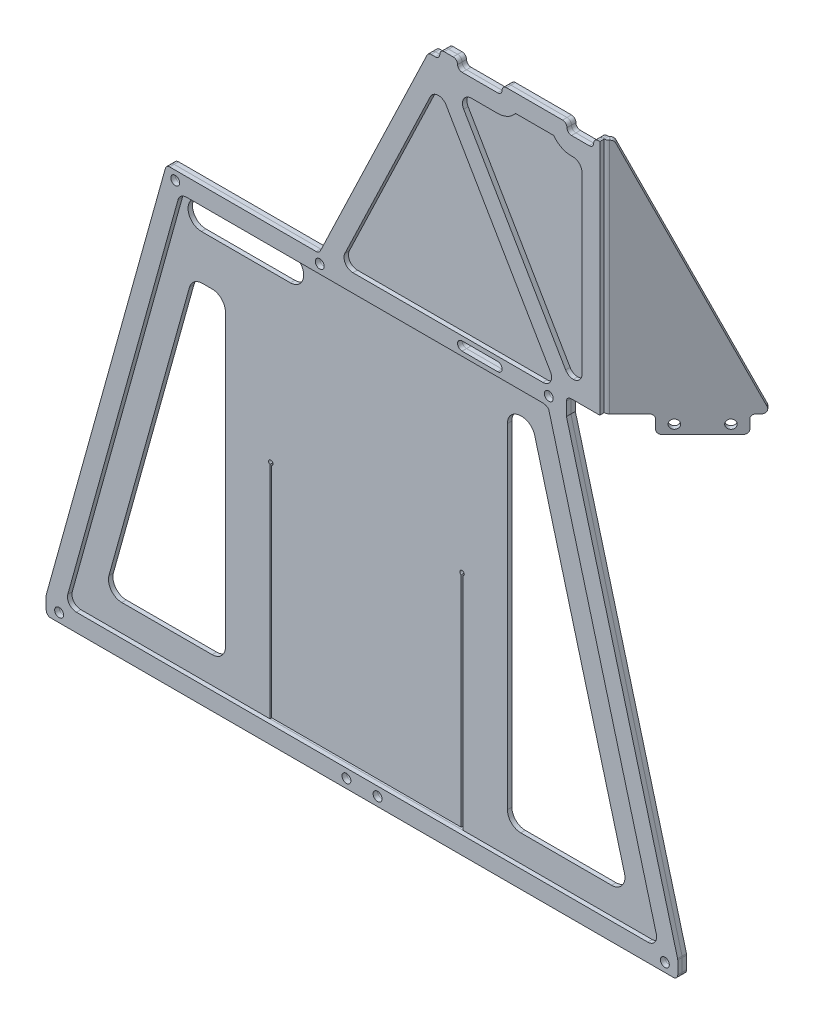
from build123d import *

# Parameters (mm, degrees)
SM_BASE_FLANGE_1_DEPTH      = 266.5
SM_BASE_FLANGE_1_DEPTH_BACK = 20
EXTRUDE_2_DEPTH             = 5
CUT_EXTRUDE_1_DEPTH         = 781.997587301
SKETCH_16_R                 = 5
CUT_EXTRUDE_6_DEPTH         = 804.201519225
CUT_EXTRUDE_7_DEPTH         = 780.82164677
SKETCH_18_W                 = 41.523044305
SKETCH_18_H                 = 20
SKETCH_18_R                 = 5
CUT_EXTRUDE_8_DEPTH         = 780.82164677
CUT_EXTRUDE_9_DEPTH         = 5
CUT_EXTRUDE_10_DEPTH        = 780.82164677
FILLET_1_R                  = 5
FILLET_2_R                  = 15
FILLET_3_R                  = 5
SKETCH_26_R                 = 5
EXTRUDE_3_DEPTH             = 5
FILLET_4_R                  = 10


# Sheet-metal steps are written as plain solids
# Some blends are built 0.0001 mm under size
with BuildPart() as part:
    # Sketch 1 → ﾍﾞｰｽ-ﾌﾗﾝｼﾞ1 (new, two sides: drawn at the far end of the back side and taken through both)
    with BuildSketch(Plane(origin=(0, 0, 0), x_dir=(1, 0, 0), z_dir=(0, 1, 0)).offset(-SM_BASE_FLANGE_1_DEPTH_BACK)):
        with BuildLine():
            Line((137.550775542, 90.408639918), (37.357880769, -9.784254855))
            ThreePointArc((37.357880769, -9.784254855), (37.11891053, -9.943929664), (36.837025914, -10))
            Line((36.837025914, -10), (30, -10))
            Line((30, -10), (-450.5, -10))
            Line((-450.5, -10), (-450.5, -15))
            Line((-450.5, -15), (30, -15))
            Line((30, -15), (36.837025914, -15))
            ThreePointArc((36.837025914, -15), (39.032327692, -14.563327326), (40.893414675, -13.319788761))
            Line((40.893414675, -13.319788761), (141.086309448, 86.873106012))
            Line((141.086309448, 86.873106012), (137.550775542, 90.408639918))
        make_face()
    extrude(amount=SM_BASE_FLANGE_1_DEPTH + SM_BASE_FLANGE_1_DEPTH_BACK)

    # ｽｹｯﾁ15 → ﾎﾞｽ - 押し出し2 (add)
    with BuildSketch(Plane.XY.offset(15)):
        Polygon((-450.5, 0), (-585.5, -486), (-585.5, -506), (124.5, -506), (124.5, -486), (-6, 0), align=None)
    extrude(amount=-EXTRUDE_2_DEPTH)

    # ｽｹｯﾁ7 → ｶｯﾄ - 押し出し1 (cut, through all)
    with BuildSketch(Plane.XY.offset(15)):
        Polygon((-278.755408603, 0), (-151.149515417, 266.5), (-450.5, 266.5), (-450.5, 0), align=None)
    extrude(amount=-CUT_EXTRUDE_1_DEPTH, mode=Mode.SUBTRACT)

    # ｽｹｯﾁ16 → ｶｯﾄ - 押し出し6 (cut, through all)
    with BuildSketch(Plane(origin=(27.106601718, 0, 27.106601718), x_dir=(0.7071067811865438, 0, -0.7071067811865513), z_dir=(0.7071067811865513, 0, 0.7071067811865438))):
        with BuildLine():
            Line((23.323748893, 266.5), (148.323748893, 0))
            Line((148.323748893, 0), (136.191648507, 0))
            ThreePointArc((136.191648507, 0), (132.656114601, -1.464466094), (131.191648507, -5))
            Line((131.191648507, -5), (131.191648507, -20))
            Line((131.191648507, -20), (141.191648507, -20))
            Line((141.191648507, -20), (161.191648507, -20))
            Line((161.191648507, -20), (161.191648507, 266.5))
            Line((161.191648507, 266.5), (23.323748893, 266.5))
        make_face()
        with BuildLine():
            Line((51.191648507, 0), (19.497497865, 0))
            Line((19.497497865, 0), (19.497497865, -20))
            Line((19.497497865, -20), (46.191648507, -20))
            Line((46.191648507, -20), (56.191648507, -20))
            Line((56.191648507, -20), (56.191648507, -5))
            ThreePointArc((56.191648507, -5), (54.727182413, -1.464466094), (51.191648507, 0))
        make_face()
        with Locations(Location((116.191648507, -10, 0), (0, 0, 180))):
            Circle(SKETCH_16_R)
        with Locations(Location((71.191648507, -10, 0), (0, 0, 180))):
            Circle(SKETCH_16_R)
    extrude(amount=-CUT_EXTRUDE_6_DEPTH, mode=Mode.SUBTRACT)

    # ｽｹｯﾁ17 → ｶｯﾄ - 押し出し7 (cut, through all)
    with BuildSketch(Plane.XY.offset(15)):
        with BuildLine():
            Line((-416.055555556, -20), (-316.055555556, -20))
            ThreePointArc((-316.055555556, -20), (-301.055555556, -35), (-316.055555556, -50))
            Line((-316.055555556, -50), (-416.055555556, -50))
            ThreePointArc((-416.055555556, -50), (-431.055555556, -35), (-416.055555556, -20))
        make_face()
    extrude(amount=-CUT_EXTRUDE_7_DEPTH, mode=Mode.SUBTRACT)

    # ｽｹｯﾁ18 → ｶｯﾄ - 押し出し8 (cut, through all)
    with BuildSketch(Plane.XY.offset(15)):
        with BuildLine():
            Line((-78, -5), (-118, -5))
            ThreePointArc((-118, -5), (-123, -10), (-118, -15))
            Line((-118, -15), (-78, -15))
            ThreePointArc((-78, -15), (-73, -10), (-78, -5))
        make_face()
        with BuildLine():
            Line((-123, 266.5), (-123, 261.5))
            ThreePointArc((-123, 261.5), (-121.535533906, 257.964466094), (-118, 256.5))
            Line((-118, 256.5), (-78, 256.5))
            ThreePointArc((-78, 256.5), (-74.464466094, 257.964466094), (-73, 261.5))
            Line((-73, 261.5), (-73, 266.5))
            Line((-73, 266.5), (-123, 266.5))
        make_face()
        with BuildLine():
            ThreePointArc((0, 261.5), (1.464466094, 257.964466094), (5, 256.5))
            Line((5, 256.5), (25, 256.5))
            ThreePointArc((25, 256.5), (28.535533906, 257.964466094), (30, 261.5))
            Line((30, 261.5), (30, 266.5))
            Line((30, 266.5), (0, 266.5))
            Line((0, 266.5), (0, 261.5))
        make_face()
        with BuildLine():
            Line((-143, 266.5), (-151.149515417, 266.5))
            Line((-151.149515417, 266.5), (-155.937729045, 256.5))
            Line((-155.937729045, 256.5), (-148, 256.5))
            ThreePointArc((-148, 256.5), (-144.464466094, 257.964466094), (-143, 261.5))
            Line((-143, 261.5), (-143, 266.5))
        make_face()
        with Locations((20.131892523, -10)):
            Rectangle(SKETCH_18_W, SKETCH_18_H)
        with Locations(Location((110, -496, 0), (0, 0, 180))):
            Circle(SKETCH_18_R)
        with Locations(Location((-571, -496, 0), (0, 0, 180))):
            Circle(SKETCH_18_R)
        with Locations(Location((-213, -496, 0), (0, 0, 180))):
            Circle(SKETCH_18_R)
        with Locations(Location((-248, -496, 0), (0, 0, 180))):
            Circle(SKETCH_18_R)
        with Locations(Location((-440.5, -10, 0), (0, 0, 180))):
            Circle(SKETCH_18_R)
        with Locations(Location((-20.5, -10, 0), (0, 0, 180))):
            Circle(SKETCH_18_R)
        with Locations(Location((-278, -10, 0), (0, 0, 180))):
            Circle(SKETCH_18_R)
    extrude(amount=-CUT_EXTRUDE_8_DEPTH, mode=Mode.SUBTRACT)

    # ｽｹｯﾁ24 → ｶｯﾄ - 押し出し9 (cut)
    with BuildSketch(Plane.XY.offset(15)):
        with BuildLine():
            ThreePointArc((-337, -238.291287847), (-338, -233.5), (-339, -238.291287847))
            Line((-339, -238.291287847), (-339, -486))
            Line((-339, -486), (-122, -486))
            Line((-122, -486), (-122, -238.291287847))
            ThreePointArc((-122, -238.291287847), (-123, -233.5), (-124, -238.291287847))
            Line((-124, -238.291287847), (-124, -484))
            Line((-124, -484), (-337, -484))
            Line((-337, -484), (-337, -238.291287847))
        make_face()
    extrude(amount=-CUT_EXTRUDE_9_DEPTH, mode=Mode.SUBTRACT)

    # ｽｹｯﾁ25 → ｶｯﾄ - 押し出し10 (cut, through all)
    with BuildSketch(Plane.XY.offset(15)):
        Polygon((-389, -238.291287847), (-389, -100), (-412.495717521, -100), (-426.38460641, -100), (-525.273495299, -456), (-389, -456), align=None)
        Polygon((-44.345258018, -50), (-72, -50), (-72, -238.291287847), (-72, -456), (64.6732605, -456), align=None)
    extrude(amount=-CUT_EXTRUDE_10_DEPTH, mode=Mode.SUBTRACT)

    # ﾌｨﾚｯﾄ1
    fillet_1_edges = [part.edges().sort_by_distance(p)[0] for p in [
        (-0.62962963, 0, 12.5),
    ]]
    fillet(fillet_1_edges, radius=FILLET_1_R)

    # ﾌｨﾚｯﾄ2
    fillet_2_edges = [part.edges().sort_by_distance(p)[0] for p in [
        (-426.38460641, -100, 12.5),
        (-389, -100, 12.5),
        (-389, -456, 12.5),
        (-525.273495299, -456, 12.5),
        (-72, -456, 12.5),
        (-72, -50, 12.5),
        (-44.345258018, -50, 12.5),
        (64.6732605, -456, 12.5),
    ]]
    fillet(fillet_2_edges, radius=FILLET_2_R)

    # ﾌｨﾚｯﾄ3
    fillet_3_edges = [part.edges().sort_by_distance(p)[0] for p in [
        (-155.937729045, 256.5, 12.5),
        (-143, 266.5, 12.5),
        (-123, 266.5, 12.5),
        (-73, 266.5, 12.5),
        (0, 266.5, 12.5),
        (30, 266.5, 12.5),
        (41.831215769, 266.5, 8.84645376),
        (130.219563418, 0, -79.541893888),
        (118.105339059, -20, -67.42766953),
        (65.07233047, -20, -14.394660941),
        (124.5, -486, 12.5),
        (124.5, -506, 12.5),
        (-585.5, -506, 12.5),
        (-585.5, -486, 12.5),
        (-450.5, 0, 12.5),
        (-278.755408603, 0, 12.5),
    ]]
    fillet(fillet_3_edges, radius=FILLET_3_R - 0.0001)  # a hair under: the kernel refuses the full size


with BuildPart() as body_2:
    # ｽｹｯﾁ26 → ﾎﾞｽ - 押し出し3 (new body)
    with BuildSketch(Plane.XY.offset(15)):
        with BuildLine():
            ThreePointArc((-0.62962963, -5), (0.834836464, -1.464466094), (4.37037037, 0))
            Line((4.37037037, 0), (36.837025914, 0))
            Line((36.837025914, 0), (36.837025914, 266.5))
            Line((36.837025914, 266.5), (35, 266.5))
            ThreePointArc((35, 266.5), (31.464466094, 265.035533906), (30, 261.5))
            ThreePointArc((30, 261.5), (28.535533906, 257.964466094), (25, 256.5))
            Line((25, 256.5), (5, 256.5))
            ThreePointArc((5, 256.5), (1.464466094, 257.964466094), (0, 261.5))
            ThreePointArc((0, 261.5), (-1.464466094, 265.035533906), (-5, 266.5))
            Line((-5, 266.5), (-68, 266.5))
            ThreePointArc((-68, 266.5), (-71.535533906, 265.035533906), (-73, 261.5))
            ThreePointArc((-73, 261.5), (-74.464466094, 257.964466094), (-78, 256.5))
            Line((-78, 256.5), (-118, 256.5))
            ThreePointArc((-118, 256.5), (-121.535533906, 257.964466094), (-123, 261.5))
            ThreePointArc((-123, 261.5), (-124.464466094, 265.035533906), (-128, 266.5))
            Line((-128, 266.5), (-138, 266.5))
            ThreePointArc((-138, 266.5), (-141.535533906, 265.035533906), (-143, 261.5))
            ThreePointArc((-143, 261.5), (-144.464466094, 257.964466094), (-148, 256.5))
            Line((-148, 256.5), (-152.788213628, 256.5))
            ThreePointArc((-152.788213628, 256.5), (-155.453108382, 255.730642498), (-157.297900428, 253.65933438))
            Line((-157.297900428, 253.65933438), (-277.395237219, 2.84066562))
            ThreePointArc((-277.395237219, 2.84066562), (-279.240029265, 0.769357502), (-281.904924019, 0))
            Line((-281.904924019, 0), (-446.699571752, 0))
            ThreePointArc((-446.699571752, 0), (-449.725204199, -1.019353282), (-451.5171613, -3.661780681))
            Line((-451.5171613, -3.661780681), (-585.317589548, -485.343322373))
            ThreePointArc((-585.317589548, -485.343322373), (-585.454187509, -486.006244625), (-585.5, -486.681541692))
            Line((-585.5, -486.681541692), (-585.5, -501))
            ThreePointArc((-585.5, -501), (-584.035533906, -504.535533906), (-580.5, -506))
            Line((-580.5, -506), (119.5, -506))
            ThreePointArc((119.5, -506), (123.035533906, -504.535533906), (124.5, -501))
            Line((124.5, -501), (124.5, -486.659613331))
            ThreePointArc((124.5, -486.659613331), (124.457050822, -486.00566597), (124.32894114, -485.36295321))
            Line((124.32894114, -485.36295321), (-0.62962963, -20))
            Line((-0.62962963, -20), (-0.62962963, -5))
        make_face()
        with Locations((-571, -496)):
            Circle(SKETCH_26_R, mode=Mode.SUBTRACT)
        with Locations((-248, -496)):
            Circle(SKETCH_26_R, mode=Mode.SUBTRACT)
        with Locations((-213, -496)):
            Circle(SKETCH_26_R, mode=Mode.SUBTRACT)
        with Locations((110, -496)):
            Circle(SKETCH_26_R, mode=Mode.SUBTRACT)
        Polygon((-435.298287009, -20), (-20.62962963, -20), (-20.62962963, -22.638453324), (103.791526422, -486), (-564.742731453, -486), align=None, mode=Mode.SUBTRACT)
        with Locations((-440.5, -10)):
            Circle(SKETCH_26_R, mode=Mode.SUBTRACT)
        with Locations((-278, -10)):
            Circle(SKETCH_26_R, mode=Mode.SUBTRACT)
        with BuildLine():
            ThreePointArc((-118, -15), (-123, -10), (-118, -5))
            Line((-118, -5), (-78, -5))
            ThreePointArc((-78, -5), (-73, -10), (-78, -15))
            Line((-78, -15), (-118, -15))
        make_face(mode=Mode.SUBTRACT)
        with Locations((-20.5, -10)):
            Circle(SKETCH_26_R, mode=Mode.SUBTRACT)
        with BuildLine():
            Line((16.837025914, 20), (4.37037037, 20))
            ThreePointArc((4.37037037, 20), (2.913171693, 19.957495307), (1.460928038, 19.830125761))
            Line((1.460928038, 19.830125761), (-125.6549482, 237.700803206))
            ThreePointArc((-125.6549482, 237.700803206), (-121.874279297, 236.802025186), (-118, 236.5))
            Line((-118, 236.5), (-78, 236.5))
            ThreePointArc((-78, 236.5), (-66.819660113, 239.139320225), (-58, 246.5))
            Line((-58, 246.5), (-15, 246.5))
            ThreePointArc((-15, 246.5), (-6.180339887, 239.139320225), (5, 236.5))
            Line((5, 236.5), (16.837025914, 236.5))
            Line((16.837025914, 236.5), (16.837025914, 20))
        make_face(mode=Mode.SUBTRACT)
        with BuildLine():
            Line((-256.58091968, 0), (-145.489713839, 232.00971066))
            Line((-145.489713839, 232.00971066), (-15.813799346, 9.751247162))
            ThreePointArc((-15.813799346, 9.751247162), (-18.495028501, 5.108092524), (-20.124527057, 0))
            Line((-20.124527057, 0), (-256.58091968, 0))
        make_face(mode=Mode.SUBTRACT)
    extrude(amount=EXTRUDE_3_DEPTH)

    # ﾌｨﾚｯﾄ4
    # the kernel refuses this fillet: 10 mm, written as the material it adds along each edge
    with BuildSketch(Plane(origin=(16.837025914, 236.5, 15), x_dir=(-1, 0, 0), z_dir=(0, 0, 1)), Plane(origin=(16.837025914, 20, 15), x_dir=(0, 1, 0), z_dir=(0, 0, 1))) as fillet_4_piece_1:
        with BuildLine():
            CenterArc((FILLET_4_R, FILLET_4_R), FILLET_4_R, 180, 90)
            Line((0, FILLET_4_R), (-FILLET_4_R * 0.02, FILLET_4_R))
            Line((-FILLET_4_R * 0.02, FILLET_4_R), (-FILLET_4_R * 0.02, -FILLET_4_R * 0.02))
            Line((-FILLET_4_R * 0.02, -FILLET_4_R * 0.02), (FILLET_4_R, -FILLET_4_R * 0.02))
            Line((FILLET_4_R, -FILLET_4_R * 0.02), (FILLET_4_R, 0))
        make_face()
    extrude(amount=5)
    with BuildSketch(Plane(origin=(-20.124527057, 0, 15), x_dir=(0.31659196881654045, 0.9485618194302713, 0), z_dir=(0, 0, 1))) as fillet_4_piece_2:
        with BuildLine():
            CenterArc((7.228988893, 9.927153726), FILLET_4_R, 198.456946279, 64.623066475)
            Line((-2.256629301, 6.761234038), (-2.446341665, 6.697915644))
            Line((-2.446341665, 6.697915644), (-0.189712364, -0.063318394))
            Line((-0.189712364, -0.063318394), (0.02409663, -0.198543075))
            ThreePointArc((0.02409663, -0.198543075), (3.012078705, -0.017884315), (6.000060781, -0.198543075))
            Line((6.000060781, -0.198543075), (6.024157411, 0))
        make_face()
    extrude(amount=5)
    with BuildSketch(Plane(origin=(-256.58091968, 0, 15), x_dir=(1, 0, 0), z_dir=(0, 0, 1))) as fillet_4_piece_3:
        with BuildLine():
            CenterArc((FILLET_4_R * 1.58754580894, FILLET_4_R), FILLET_4_R, 154.413904759, 115.586095241)
            Line((FILLET_4_R * 0.68560844887, FILLET_4_R * 1.43186687591), (FILLET_4_R * 0.667569701668, FILLET_4_R * 1.44050421343))
            Line((FILLET_4_R * 0.667569701668, FILLET_4_R * 1.44050421343), (-FILLET_4_R * 0.0317509161788, -FILLET_4_R * 0.02))
            Line((-FILLET_4_R * 0.0317509161788, -FILLET_4_R * 0.02), (FILLET_4_R * 1.58754580894, -FILLET_4_R * 0.02))
            Line((FILLET_4_R * 1.58754580894, -FILLET_4_R * 0.02), (FILLET_4_R * 1.58754580894, 0))
        make_face()
    extrude(amount=5)
    with BuildSketch(Plane(origin=(-20.62962963, -20, 15), x_dir=(-1, 0, 0), z_dir=(0, 0, 1))) as fillet_4_piece_4:
        with BuildLine():
            CenterArc((6.76813346, 10), FILLET_4_R, 227.404874266, 42.595125734)
            Line((0, 2.638453324), (-0.135362669, 2.49122239))
            ThreePointArc((-0.135362669, 2.49122239), (-0.2, 1.319226662), (-0.2, 0))
            Line((-0.2, 0), (0, -0.2))
            Line((0, -0.2), (6.76813346, -0.2))
            Line((6.76813346, -0.2), (6.76813346, 0))
        make_face()
    extrude(amount=5)
    with BuildSketch(Plane(origin=(103.791526422, -486, 15), x_dir=(-1, 0, 0), z_dir=(0, 0, 1))) as fillet_4_piece_5:
        with BuildLine():
            CenterArc((FILLET_4_R * 1.3039421974, -FILLET_4_R), FILLET_4_R, 90, 105.030430523)
            Line((FILLET_4_R * 0.338153969453, -FILLET_4_R * 1.25933202417), (FILLET_4_R * 0.318838204894, -FILLET_4_R * 1.26451866465))
            Line((FILLET_4_R * 0.318838204894, -FILLET_4_R * 1.26451866465), (-FILLET_4_R * 0.026078843948, FILLET_4_R * 0.02))
            Line((-FILLET_4_R * 0.026078843948, FILLET_4_R * 0.02), (FILLET_4_R * 1.3039421974, FILLET_4_R * 0.02))
            Line((FILLET_4_R * 1.3039421974, FILLET_4_R * 0.02), (FILLET_4_R * 1.3039421974, 0))
        make_face()
    extrude(amount=5)
    with BuildSketch(Plane(origin=(-564.742731453, -486, 15), x_dir=(1, 0, 0), z_dir=(0, 0, 1))) as fillet_4_piece_6:
        with BuildLine():
            CenterArc((FILLET_4_R * 1.31564120513, FILLET_4_R), FILLET_4_R, 164.475889003, 105.524110997)
            Line((FILLET_4_R * 0.352123295496, FILLET_4_R * 1.26764386379), (FILLET_4_R * 0.332852937304, FILLET_4_R * 1.27299674106))
            Line((FILLET_4_R * 0.332852937304, FILLET_4_R * 1.27299674106), (-FILLET_4_R * 0.0263128241025, -FILLET_4_R * 0.02))
            Line((-FILLET_4_R * 0.0263128241025, -FILLET_4_R * 0.02), (FILLET_4_R * 1.31564120513, -FILLET_4_R * 0.02))
            Line((FILLET_4_R * 1.31564120513, -FILLET_4_R * 0.02), (FILLET_4_R * 1.31564120513, 0))
        make_face()
    extrude(amount=5)
    with BuildSketch(Plane(origin=(-435.298287009, -20, 15), x_dir=(-0.2676438637860963, -0.9635179096299402, 0), z_dir=(0, 0, 1))) as fillet_4_piece_7:
        with BuildLine():
            CenterArc((FILLET_4_R * 0.760085649571, FILLET_4_R), FILLET_4_R, 195.524110997, 74.475889003)
            Line((-FILLET_4_R * 0.203432260059, FILLET_4_R * 0.732356136214), (-FILLET_4_R * 0.222702618252, FILLET_4_R * 0.727003258938))
            Line((-FILLET_4_R * 0.222702618252, FILLET_4_R * 0.727003258938), (-FILLET_4_R * 0.0152017129914, -FILLET_4_R * 0.02))
            Line((-FILLET_4_R * 0.0152017129914, -FILLET_4_R * 0.02), (FILLET_4_R * 0.760085649571, -FILLET_4_R * 0.02))
            Line((FILLET_4_R * 0.760085649571, -FILLET_4_R * 0.02), (FILLET_4_R * 0.760085649571, 0))
        make_face()
    extrude(amount=5)
    with BuildSketch(Plane(origin=(-15.813799346, 9.751247162, 15), x_dir=(-0.5079095403569047, -0.8614104125296127, 0), z_dir=(0, 0, 1))) as fillet_4_piece_8:
        with BuildLine():
            CenterArc((5.892349296, -9.951661251), FILLET_4_R, 95.63586305, 55.150095421)
            Line((-2.835675612, -5.070925528), (-3.01023611, -4.973310814))
            Line((-3.01023611, -4.973310814), (-0.174560498, 0.097614714))
            Line((-0.174560498, 0.097614714), (0.019641164, 0.199033225))
            ThreePointArc((0.019641164, 0.199033225), (2.45514554, 0.079153128), (4.890649916, 0.199033225))
            Line((4.890649916, 0.199033225), (4.91029108, 0))
        make_face()
    extrude(amount=5)
    with BuildSketch(Plane(origin=(1.460928038, 19.830125761, 15), x_dir=(0.9995473614429236, 0.030084418433625887, 0), z_dir=(0, 0, 1))) as fillet_4_piece_9:
        with BuildLine():
            CenterArc((5.947429617, 9.995473614), FILLET_4_R, 208.537302819, 59.738726856)
            Line((-2.837633071, 5.218165423), (-3.71613934, 4.740434604))
            Line((-3.71613934, 4.740434604), (-0.878506269, -0.477730819))
            Line((-0.878506269, -0.477730819), (0.086445021, -0.996256623))
            ThreePointArc((0.086445021, -0.996256623), (2.883151556, -0.917278895), (5.616501015, -0.999547361))
            Line((5.616501015, -0.999547361), (5.646585433, 0))
        make_face()
    extrude(amount=5)
    with BuildSketch(Plane(origin=(-125.6549482, 237.700803206, 15), x_dir=(0.5039439299359273, -0.8637363692011197, 0), z_dir=(0, 0, 1))) as fillet_4_piece_10:
        with BuildLine():
            CenterArc((18.80231409, 10), FILLET_4_R, 149.738726856, 120.261273144)
            Line((10.164950398, 15.039439299), (9.301214029, 15.543383229))
            ThreePointArc((9.301214029, 15.543383229), (4.031105711, 6.510663608), (-0.667942686, 0.744212717))
            Line((-0.667942686, 0.744212717), (0, -1))
            Line((0, -1), (18.80231409, -1))
            Line((18.80231409, -1), (18.80231409, 0))
        make_face()
    extrude(amount=5)
    with BuildSketch(Plane(origin=(-145.489713839, 232.00971066, 15), x_dir=(-0.431866875908974, -0.9019373600714313, 0), z_dir=(0, 0, 1))) as fillet_4_piece_11:
        with BuildLine():
            CenterArc((FILLET_4_R * 1.88678493371, FILLET_4_R), FILLET_4_R, 145.847368385, 124.152631615)
            Line((FILLET_4_R * 1.05923994855, FILLET_4_R * 1.56139940998), (FILLET_4_R * 1.04268904884, FILLET_4_R * 1.57262739818))
            Line((FILLET_4_R * 1.04268904884, FILLET_4_R * 1.57262739818), (-FILLET_4_R * 0.0165508997033, FILLET_4_R * 0.0112279881996))
            Line((-FILLET_4_R * 0.0165508997033, FILLET_4_R * 0.0112279881996), (0, -FILLET_4_R * 0.02))
            Line((0, -FILLET_4_R * 0.02), (FILLET_4_R * 1.88678493371, -FILLET_4_R * 0.02))
            Line((FILLET_4_R * 1.88678493371, -FILLET_4_R * 0.02), (FILLET_4_R * 1.88678493371, 0))
        make_face()
    extrude(amount=5)


solid = Compound([part.part, body_2.part])
